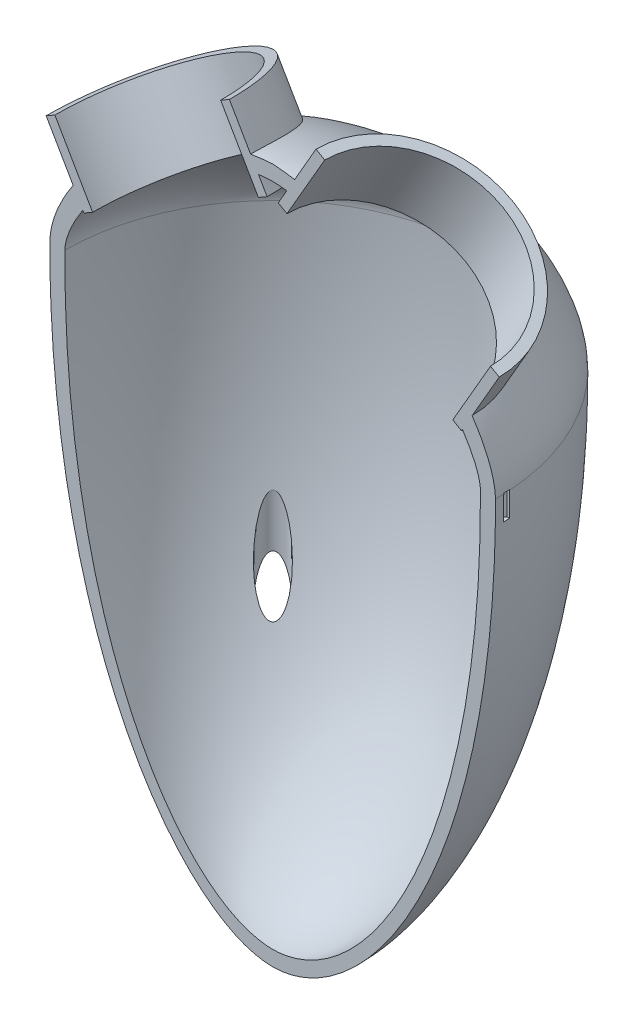
from build123d import *

# Parameters (mm, degrees)
SKETCH11_R              = 21.025
BOSS_EXTRUDE1_DEPTH     = 15
CUT_EXTRUDE1_DEPTH      = 15
CUT_EXTRUDE1_DEPTH_BACK = 15
SKETCH10_R              = 19.025
SKETCH9_R               = 21.025
BOSS_EXTRUDE2_DEPTH     = 15
CUT_EXTRUDE2_DEPTH      = 15
CUT_EXTRUDE2_DEPTH_BACK = 15
SKETCH8_R               = 19.025
SKETCH12_W              = 105.912450518
SKETCH12_H              = 158.657694799
CUT_EXTRUDE3_DEPTH      = 121.569942687
CAVITY2_START           = -4.850549651
CAVITY2_DEPTH           = 5
SKETCH13_R              = 2.75
CUT_EXTRUDE4_DEPTH      = 121.569942687
CIRPATTERN1_COUNT       = 4


# Read off the part's stored shape, not the designer's step: Cavity2
with BuildPart() as part:
    # Sketch1 → Revolve1 (revolve)
    with BuildSketch(Plane.XY):
        with BuildLine():
            Line((-0.054587449, 35.519508176), (-0.054587449, 32.519508176))
            add(Edge.make_bspline(
                [(41.245411777, 0.01672709), (40.937071386, 9.678474895), (19.273382765, 32.064156486), (-0.054587449, 32.519508176)],
                knots=[0, 0, 0, 0, 1, 1, 1, 1], degree=3))
            add(Edge.make_bspline(
                [(41.245411777, 0.01672709), (41.577917268, -63.315733396), (18.687364585, -99.514781639), (-0.054587449, -99.680491824)],
                knots=[0, 0, 0, 0, 1, 1, 1, 1], degree=3))
            Line((-0.054587449, -99.680491824), (-0.054587449, -102.680491824))
            add(Edge.make_bspline(
                [(44.245411313, 0.015058438), (44.245411313, -67.803018651), (17.945412551, -102.680491824), (-0.054587449, -102.680491824)],
                knots=[0, 0, 0, 0, 1, 1, 1, 1], degree=3))
            add(Edge.make_bspline(
                [(44.245411313, 0.015058438), (43.865691504, 13.009511596), (22.571041074, 34.156162401), (-0.054587449, 35.519508176)],
                knots=[0, 0, 0, 0, 1, 1, 1, 1], degree=3))
        make_face()
    revolve(axis=Axis((-0.054587449, 0.019508176, 0), (0, -1, 0)))

    # Sketch11 → Boss-Extrude1 (add)
    with BuildSketch(Plane(origin=(12.990381057, 22.5, 0), x_dir=(0, 0, -1), z_dir=(0.500000000000001, 0.866025403784438, 0))):
        with Locations(Location((0, -7.255196663, 0), (0, 0, 90))):
            Circle(SKETCH11_R)
    extrude(amount=BOSS_EXTRUDE1_DEPTH)

    # Sketch10 → Cut-Extrude1 (cut, two sides: drawn at the far end of the back side and taken through both)
    with BuildSketch(Plane(origin=(12.990381057, 22.5, 0), x_dir=(0, 0, -1), z_dir=(0.500000000000001, 0.866025403784438, 0)).offset(-CUT_EXTRUDE1_DEPTH_BACK)):
        with Locations(Location((0, -7.255196663, 0), (0, 0, 90))):
            Circle(SKETCH10_R)
    extrude(amount=CUT_EXTRUDE1_DEPTH + CUT_EXTRUDE1_DEPTH_BACK, mode=Mode.SUBTRACT)

    # Sketch9 → Boss-Extrude2 (add)
    with BuildSketch(Plane(origin=(-12.990381057, 22.5, 0), x_dir=(0, 0, -1), z_dir=(-0.4999999999999889, 0.866025403784445, 0))):
        with Locations(Location((0, 7.35752003, 0), (0, 0, 270))):
            Circle(SKETCH9_R)
    extrude(amount=BOSS_EXTRUDE2_DEPTH)

    # Sketch8 → Cut-Extrude2 (cut, two sides: drawn at the far end of the back side and taken through both)
    with BuildSketch(Plane(origin=(-12.990381057, 22.5, 0), x_dir=(0, 0, -1), z_dir=(-0.4999999999999889, 0.866025403784445, 0)).offset(-CUT_EXTRUDE2_DEPTH_BACK)):
        with Locations(Location((0, 7.359744899, 0), (0, 0, 90))):
            Circle(SKETCH8_R)
    extrude(amount=CUT_EXTRUDE2_DEPTH + CUT_EXTRUDE2_DEPTH_BACK, mode=Mode.SUBTRACT)

    # Sketch12 → Cut-Extrude3 (cut, through all)
    with BuildSketch(Plane.XY):
        with Locations((1.11512466, -27.558124424)):
            Rectangle(SKETCH12_W, SKETCH12_H)
    extrude(amount=CUT_EXTRUDE3_DEPTH, mode=Mode.SUBTRACT)

    # Cavity2 outline → Cavity2 (cut)
    with BuildSketch(Plane(origin=(0, 0, 0), x_dir=(1, 0, 0), z_dir=(0, 1, 0)).offset(CAVITY2_START)):
        Polygon((45, 2.911939182), (43.645163003, 2.911939182), (42.296027354, 1.666583198), (45, 1.666583198), align=None)
        Polygon((-43.817733402, 2.911939182), (-45, 2.911939182), (-45, 1.666583198), (-42.468597752, 1.666583198), align=None)
    extrude(amount=CAVITY2_DEPTH, mode=Mode.SUBTRACT)

    # Sketch13 → Cut-Extrude4 (cut, through all)
    with BuildSketch(Plane(origin=(0, 0, 0), x_dir=(1, 0, 0), z_dir=(0, 1, 0))):
        with Locations(Location((-24.05, 24.05, 0), (0, 0, 270))):
            Circle(SKETCH13_R)
    cut_extrude4 = extrude(amount=-CUT_EXTRUDE4_DEPTH, mode=Mode.SUBTRACT)

    # CirPattern1: Cut-Extrude4 ×4 about axis
    cirpattern1_axis = Axis((-0.054587449, 0.015058438, 0), (0, 1, 0))
    for i in range(1, CIRPATTERN1_COUNT):
        add(cut_extrude4.rotate(cirpattern1_axis, i * 360 / CIRPATTERN1_COUNT), mode=Mode.SUBTRACT)


solid = part.part
